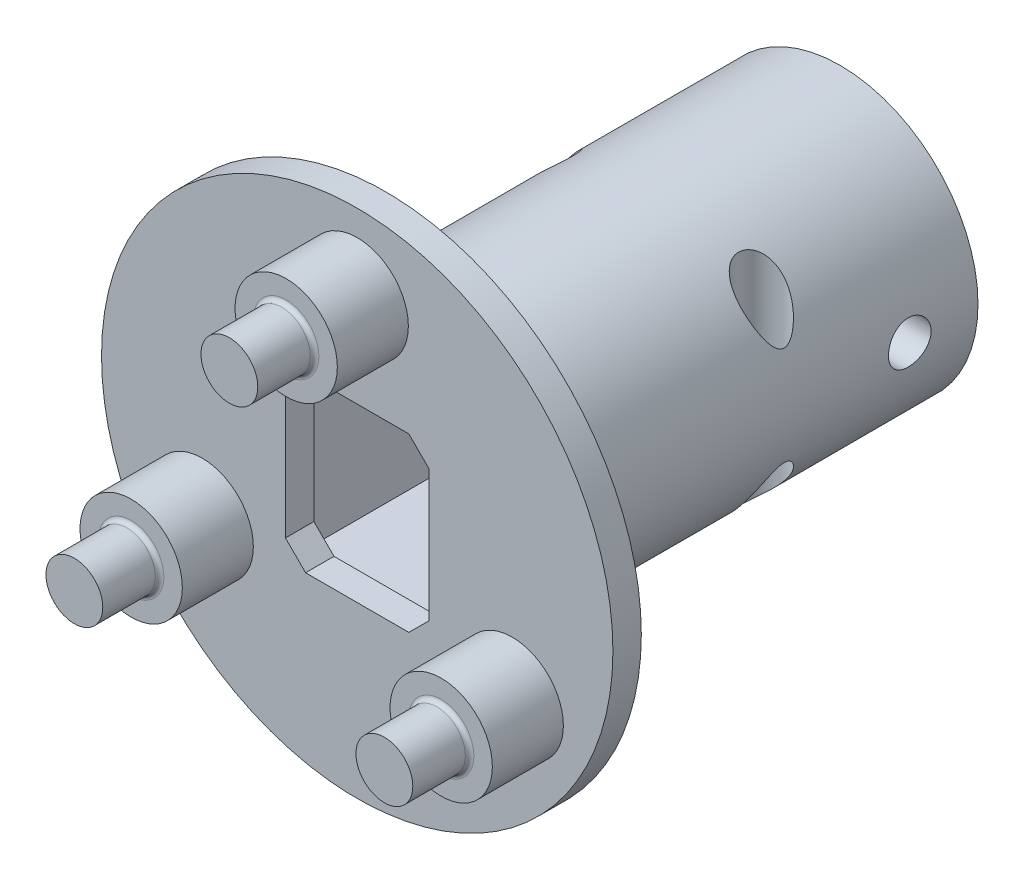
from build123d import *
from build123d.topology import SkipClean

# Parameters (mm, degrees)
SKETCH1_R               = 9.7
SKETCH1_W               = 10.1
SKETCH1_H               = 12.1
BOSS_EXTRUDE1_DEPTH     = 34
BOSS_EXTRUDE2_DEPTH     = 4
SKETCH7_W               = 10.1
SKETCH7_H               = 12.1
CUT_EXTRUDE3_DEPTH      = 2
CUT_EXTRUDE4_REACH      = 38.511
CUT_EXTRUDE5_DEPTH      = 39.275740737
CUT_EXTRUDE5_DEPTH_BACK = 39.275740737
SKETCH10_R              = 1.6
CUT_EXTRUDE6_DEPTH      = 41.209263059
CUT_EXTRUDE6_DEPTH_BACK = 41.209263059
SKETCH12_R              = 1.5
SKETCH13_R              = 14.7
SKETCH13_R_2            = 9.7
CUT_EXTRUDE_THIN1_DEPTH = 39.275740826
BOSS_EXTRUDE3_START     = -2
SKETCH15_R              = 18
SKETCH15_R_2            = 9.7
BOSS_EXTRUDE3_DEPTH     = 2
SKETCH26_R              = 3.6
BOSS_EXTRUDE9_DEPTH     = 12.5
SKETCH27_R              = 2
BOSS_EXTRUDE10_DEPTH    = 5.5
CIRPATTERN1_COUNT       = 3
SKETCH19_R              = 2.5
BOSS_EXTRUDE6_DEPTH     = 4
SKETCH20_W              = 10.3
SKETCH20_H              = 12.3
SKETCH20_W_2            = 10.1
SKETCH20_H_2            = 12.1
CUT_EXTRUDE_THIN2_DEPTH = 21.5
CHAMFER1_SIZE           = 0.1
SKETCH23_W              = 10.3
SKETCH23_H              = 12.3
CUT_EXTRUDE7_DEPTH      = 32
CUT_EXTRUDE8_START      = -4
CUT_EXTRUDE8_DEPTH      = 4
FILLET1_R               = 0.3
CUT_EXTRUDE9_START      = -0.5
SKETCH29_R              = 3.6
SKETCH29_R_2            = 2
CUT_EXTRUDE9_DEPTH      = 0.5
CUT_EXTRUDE10_START     = -0.5
SKETCH30_R              = 2
CUT_EXTRUDE10_DEPTH     = 0.5
CUT_EXTRUDE11_START     = -7
SKETCH31_R              = 3.6
SKETCH31_R_2            = 2
CUT_EXTRUDE11_DEPTH     = 7
CUT_EXTRUDE12_START     = -8.5
SKETCH32_R              = 2
CUT_EXTRUDE12_DEPTH     = 8.5
FILLET2_R               = 0.3


# Some blends are built 0.0001 mm under size
with BuildPart() as part:
    # Sketch1 → Boss-Extrude1 (new body)
    with BuildSketch(Plane.XY):
        Circle(SKETCH1_R)
        Rectangle(SKETCH1_W, SKETCH1_H, mode=Mode.SUBTRACT)
    extrude(amount=BOSS_EXTRUDE1_DEPTH)

    # Sketch5 → Boss-Extrude2 (add)
    with BuildSketch(Plane.XY.offset(34)):
        with BuildLine():
            ThreePointArc((-3.902147571, 8.865750199), (-4.761039652, 10.097562259), (-5.97741096, 10.978185561))
            ThreePointArc((-5.97741096, 10.978185561), (-6.25, 10.825317547), (-6.518682103, 10.665682521))
            ThreePointArc((-6.518682103, 10.665682521), (-6.364225607, 9.171962417), (-5.72689111, 7.812234025))
            ThreePointArc((-5.72689111, 7.812234025), (-6.226362181, 7.420289498), (-6.699084431, 6.996466968))
            ThreePointArc((-6.699084431, 6.996466968), (-7.927483519, 7.860233279), (-9.37168957, 8.271725008))
            ThreePointArc((-9.37168957, 8.271725008), (-9.575555539, 8.034845121), (-9.773435734, 7.792942573))
            ThreePointArc((-9.773435734, 7.792942573), (-9.11741174, 6.442132047), (-8.053458717, 5.382386547))
            ThreePointArc((-8.053458717, 5.382386547), (-8.388755074, 4.84325), (-8.688012841, 4.283306564))
            ThreePointArc((-8.688012841, 4.283306564), (-10.137755877, 4.67484416), (-11.635604106, 4.567572341))
            ThreePointArc((-11.635604106, 4.567572341), (-11.74615776, 4.275251792), (-11.849368775, 3.98025874))
            ThreePointArc((-11.849368775, 3.98025874), (-10.770903459, 2.935285476), (-9.408660347, 2.303343816))
            ThreePointArc((-9.408660347, 2.303343816), (-9.5393403, 1.682043073), (-9.629038681, 1.053516174))
            ThreePointArc((-9.629038681, 1.053516174), (-11.125265259, 0.925599843), (-12.496093063, 0.31250304))
            ThreePointArc((-12.496093063, 0.31250304), (-12.5, 0), (-12.496093063, -0.31250304))
            ThreePointArc((-12.496093063, -0.31250304), (-11.125265259, -0.925599843), (-9.629038681, -1.053516174))
            ThreePointArc((-9.629038681, -1.053516174), (-9.5393403, -1.682043073), (-9.408660347, -2.303343816))
            ThreePointArc((-9.408660347, -2.303343816), (-10.770903459, -2.935285476), (-11.849368775, -3.98025874))
            ThreePointArc((-11.849368775, -3.98025874), (-11.74615776, -4.275251792), (-11.635604106, -4.567572341))
            ThreePointArc((-11.635604106, -4.567572341), (-10.137755877, -4.67484416), (-8.688012841, -4.283306564))
            ThreePointArc((-8.688012841, -4.283306564), (-8.388755074, -4.84325), (-8.053458717, -5.382386547))
            ThreePointArc((-8.053458717, -5.382386547), (-9.11741174, -6.442132047), (-9.773435734, -7.792942573))
            ThreePointArc((-9.773435734, -7.792942573), (-9.575555539, -8.034845121), (-9.37168957, -8.271725008))
            ThreePointArc((-9.37168957, -8.271725008), (-7.927483519, -7.860233279), (-6.699084431, -6.996466968))
            ThreePointArc((-6.699084431, -6.996466968), (-6.226362181, -7.420289498), (-5.72689111, -7.812234025))
            ThreePointArc((-5.72689111, -7.812234025), (-6.364225607, -9.171962417), (-6.518682103, -10.665682521))
            ThreePointArc((-6.518682103, -10.665682521), (-6.25, -10.825317547), (-5.97741096, -10.978185561))
            ThreePointArc((-5.97741096, -10.978185561), (-4.761039652, -10.097562259), (-3.902147571, -8.865750199))
            ThreePointArc((-3.902147571, -8.865750199), (-3.312978118, -9.102332571), (-2.709575915, -9.299810784))
            ThreePointArc((-2.709575915, -9.299810784), (-2.84341994, -10.795518755), (-2.477679205, -12.251983748))
            ThreePointArc((-2.477679205, -12.251983748), (-2.170602221, -12.310096913), (-1.862168372, -12.360514915))
            ThreePointArc((-1.862168372, -12.360514915), (-1.020344137, -11.116976207), (-0.634554124, -9.665693111))
            ThreePointArc((-0.634554124, -9.665693111), (0, -9.6865), (0.634554124, -9.665693111))
            ThreePointArc((0.634554124, -9.665693111), (1.020344137, -11.116976207), (1.862168372, -12.360514915))
            ThreePointArc((1.862168372, -12.360514915), (2.170602221, -12.310096913), (2.477679205, -12.251983748))
            ThreePointArc((2.477679205, -12.251983748), (2.84341994, -10.795518755), (2.709575915, -9.299810784))
            ThreePointArc((2.709575915, -9.299810784), (3.312978118, -9.102332571), (3.902147571, -8.865750199))
            ThreePointArc((3.902147571, -8.865750199), (4.761039652, -10.097562259), (5.97741096, -10.978185561))
            ThreePointArc((5.97741096, -10.978185561), (6.25, -10.825317547), (6.518682103, -10.665682521))
            ThreePointArc((6.518682103, -10.665682521), (6.364225607, -9.171962417), (5.72689111, -7.812234025))
            ThreePointArc((5.72689111, -7.812234025), (6.226362181, -7.420289498), (6.699084431, -6.996466968))
            ThreePointArc((6.699084431, -6.996466968), (7.927483519, -7.860233279), (9.37168957, -8.271725008))
            ThreePointArc((9.37168957, -8.271725008), (9.575555539, -8.034845121), (9.773435734, -7.792942573))
            ThreePointArc((9.773435734, -7.792942573), (9.11741174, -6.442132047), (8.053458717, -5.382386547))
            ThreePointArc((8.053458717, -5.382386547), (8.388755074, -4.84325), (8.688012841, -4.283306564))
            ThreePointArc((8.688012841, -4.283306564), (10.137755877, -4.67484416), (11.635604106, -4.567572341))
            ThreePointArc((11.635604106, -4.567572341), (11.74615776, -4.275251792), (11.849368775, -3.98025874))
            ThreePointArc((11.849368775, -3.98025874), (10.770903459, -2.935285476), (9.408660347, -2.303343816))
            ThreePointArc((9.408660347, -2.303343816), (9.5393403, -1.682043073), (9.629038681, -1.053516174))
            ThreePointArc((9.629038681, -1.053516174), (11.125265259, -0.925599843), (12.496093063, -0.31250304))
            ThreePointArc((12.496093063, -0.31250304), (12.5, 0), (12.496093063, 0.31250304))
            ThreePointArc((12.496093063, 0.31250304), (11.125265259, 0.925599843), (9.629038681, 1.053516174))
            ThreePointArc((9.629038681, 1.053516174), (9.5393403, 1.682043073), (9.408660347, 2.303343816))
            ThreePointArc((9.408660347, 2.303343816), (10.770903459, 2.935285476), (11.849368775, 3.98025874))
            ThreePointArc((11.849368775, 3.98025874), (11.74615776, 4.275251792), (11.635604106, 4.567572341))
            ThreePointArc((11.635604106, 4.567572341), (10.137755877, 4.67484416), (8.688012841, 4.283306564))
            ThreePointArc((8.688012841, 4.283306564), (8.388755074, 4.84325), (8.053458717, 5.382386547))
            ThreePointArc((8.053458717, 5.382386547), (9.11741174, 6.442132047), (9.773435734, 7.792942573))
            ThreePointArc((9.773435734, 7.792942573), (9.575555539, 8.034845121), (9.37168957, 8.271725008))
            ThreePointArc((9.37168957, 8.271725008), (7.927483519, 7.860233279), (6.699084431, 6.996466968))
            ThreePointArc((6.699084431, 6.996466968), (6.226362181, 7.420289498), (5.72689111, 7.812234025))
            ThreePointArc((5.72689111, 7.812234025), (6.364225607, 9.171962417), (6.518682103, 10.665682521))
            ThreePointArc((6.518682103, 10.665682521), (6.25, 10.825317547), (5.97741096, 10.978185561))
            ThreePointArc((5.97741096, 10.978185561), (4.761039652, 10.097562259), (3.902147571, 8.865750199))
            ThreePointArc((3.902147571, 8.865750199), (3.312978118, 9.102332571), (2.709575915, 9.299810784))
            ThreePointArc((2.709575915, 9.299810784), (2.84341994, 10.795518755), (2.477679205, 12.251983748))
            ThreePointArc((2.477679205, 12.251983748), (2.170602221, 12.310096913), (1.862168372, 12.360514915))
            ThreePointArc((1.862168372, 12.360514915), (1.020344137, 11.116976207), (0.634554124, 9.665693111))
            ThreePointArc((0.634554124, 9.665693111), (0, 9.6865), (-0.634554124, 9.665693111))
            ThreePointArc((-0.634554124, 9.665693111), (-1.020344137, 11.116976207), (-1.862168372, 12.360514915))
            ThreePointArc((-1.862168372, 12.360514915), (-2.170602221, 12.310096913), (-2.477679205, 12.251983748))
            ThreePointArc((-2.477679205, 12.251983748), (-2.84341994, 10.795518755), (-2.709575915, 9.299810784))
            ThreePointArc((-2.709575915, 9.299810784), (-3.312978118, 9.102332571), (-3.902147571, 8.865750199))
        make_face()
    extrude(amount=-BOSS_EXTRUDE2_DEPTH)

    # Sketch7 → Cut-Extrude3 (cut)
    with BuildSketch(Plane(origin=(0, 0, 30), x_dir=(-1, 0, 0), z_dir=(0, 0, -1))):
        Rectangle(SKETCH7_W, SKETCH7_H)
    extrude(amount=-CUT_EXTRUDE3_DEPTH, mode=Mode.SUBTRACT)

    # Sketch8 → Cut-Extrude4 (cut, up to next)
    with BuildSketch(Plane(origin=(0, 0, 32), x_dir=(-1, 0, 0), z_dir=(0, 0, -1)), mode=Mode.PRIVATE) as cut_extrude4_sk1:
        Polygon((-5.05, -4.635786438), (-3.635786438, -6.05), (3.635786438, -6.05), (5.05, -4.635786438), (5.05, 4.635786438), (3.635786438, 6.05), (-3.635786438, 6.05), (-5.05, 4.635786438), align=None)
    cut_extrude4_tool1 = extrude(cut_extrude4_sk1.sketch, amount=-CUT_EXTRUDE4_REACH, mode=Mode.PRIVATE) & part.part
    add(cut_extrude4_tool1.solids().sort_by_distance((0, 0, 32))[0], mode=Mode.SUBTRACT)

    # Sketch10 → Cut-Extrude5 (cut, two sides: drawn at the far end of the back side and taken through both)
    with BuildSketch(Plane(origin=(0, 0, 0), x_dir=(1, 0, 0), z_dir=(0, 1, 0)).offset(-CUT_EXTRUDE5_DEPTH_BACK)):
        with Locations(Location((7.45, -13, 0), (0, 0, 270))):
            Circle(SKETCH10_R)
        with Locations(Location((-7.45, -13, 0), (0, 0, 270))):
            Circle(SKETCH10_R)
    extrude(amount=CUT_EXTRUDE5_DEPTH + CUT_EXTRUDE5_DEPTH_BACK, mode=Mode.SUBTRACT)

    # Sketch12 → Cut-Extrude6 (cut, two sides: drawn at the far end of the back side and taken through both)
    with BuildSketch(Plane.ZY.offset(-5.05).offset(-CUT_EXTRUDE6_DEPTH_BACK)):
        with Locations(Location((4.8, 0, 0), (0, 0, 270))):
            Circle(SKETCH12_R)
    extrude(amount=CUT_EXTRUDE6_DEPTH + CUT_EXTRUDE6_DEPTH_BACK, mode=Mode.SUBTRACT)

    # Sketch13 → Cut-Extrude-Thin1 (cut, through all)
    with SkipClean():  # the faces are left unmerged after this step: merging them gives an invalid solid
        with BuildSketch(Plane(origin=(0, 0, 0), x_dir=(-1, 0, 0), z_dir=(0, 0, -1))):
            Circle(SKETCH13_R)
            Circle(SKETCH13_R_2, mode=Mode.SUBTRACT)
        extrude(amount=-CUT_EXTRUDE_THIN1_DEPTH, mode=Mode.SUBTRACT)
    add(part.part.scale(1), mode=Mode.REPLACE)  # the faces are merged on a copy

    # Sketch15 → Boss-Extrude3 (add)
    with BuildSketch(Plane.XY.offset(34).offset(BOSS_EXTRUDE3_START)):
        Circle(SKETCH15_R)
        Circle(SKETCH15_R_2, mode=Mode.SUBTRACT)
    extrude(amount=BOSS_EXTRUDE3_DEPTH)

    # Sketch26 → Boss-Extrude9 (add)
    with BuildSketch(Plane.XY.offset(34)):
        with Locations((0, 12.6)):
            Circle(SKETCH26_R)
    boss_extrude9 = extrude(amount=BOSS_EXTRUDE9_DEPTH)

    # Sketch27 → Boss-Extrude10 (add)
    with BuildSketch(Plane.XY.offset(46.5)):
        with Locations((0, 12.6)):
            Circle(SKETCH27_R)
    boss_extrude10 = extrude(amount=BOSS_EXTRUDE10_DEPTH)

    # CirPattern1: Boss-Extrude9, Boss-Extrude10 ×3 about axis
    cirpattern1_axis = Axis((0, 0, 0), (0, 0, 1))
    add([boss_extrude9.rotate(cirpattern1_axis, i * 360 / CIRPATTERN1_COUNT) for i in range(1, CIRPATTERN1_COUNT)])
    add([boss_extrude10.rotate(cirpattern1_axis, i * 360 / CIRPATTERN1_COUNT) for i in range(1, CIRPATTERN1_COUNT)])

    # Sketch19 → Boss-Extrude6 (add)
    with BuildSketch(Plane(origin=(0, 0, 32), x_dir=(-1, 0, 0), z_dir=(0, 0, -1))):
        with Locations(Location((15.316989719, 5.574928336, 0), (0, 0, 70.299613612))):
            Circle(SKETCH19_R)
    extrude(amount=BOSS_EXTRUDE6_DEPTH)

    # Sketch20 → Cut-Extrude-Thin2 (cut)
    with BuildSketch(Plane(origin=(0, 0, 0), x_dir=(-1, 0, 0), z_dir=(0, 0, -1))):
        Rectangle(SKETCH20_W, SKETCH20_H)
        Rectangle(SKETCH20_W_2, SKETCH20_H_2, mode=Mode.SUBTRACT)
    extrude(amount=-CUT_EXTRUDE_THIN2_DEPTH, mode=Mode.SUBTRACT)

    # Chamfer1
    chamfer1_edges = [part.edges().sort_by_distance(p)[0] for p in [
        (5.05, 0, 21.5),
        (0, -6.05, 21.5),
        (-5.05, 0, 21.5),
        (0, 6.05, 21.5),
    ]]
    chamfer(chamfer1_edges, length=CHAMFER1_SIZE - 0.0001)  # a hair under: the kernel refuses the full size

    # Sketch23 → Cut-Extrude7 (cut)
    with BuildSketch(Plane(origin=(0, 0, 0), x_dir=(-1, 0, 0), z_dir=(0, 0, -1))):
        Rectangle(SKETCH23_W, SKETCH23_H)
    extrude(amount=-CUT_EXTRUDE7_DEPTH, mode=Mode.SUBTRACT)

    # Sketch28 → Cut-Extrude8 (cut)
    with BuildSketch(Plane(origin=(0, 0, 28), x_dir=(-1, 0, 0), z_dir=(0, 0, -1)).offset(CUT_EXTRUDE8_START)):
        with BuildLine():
            ThreePointArc((14.77091445, 3.135296848), (14.189358574, 5.164504164), (13.3305069, 7.092784064))
            ThreePointArc((13.3305069, 7.092784064), (12.967758167, 4.719877978), (14.77091445, 3.135296848))
        make_face()
        with BuildLine():
            ThreePointArc((17.081562792, 3.803973263), (16.444620864, 5.985352508), (15.530383138, 8.065804336))
            ThreePointArc((15.530383138, 8.065804336), (17.666221271, 6.429978695), (17.081562792, 3.803973263))
        make_face()
    extrude(amount=CUT_EXTRUDE8_DEPTH, mode=Mode.SUBTRACT)

    # Fillet1
    # the kernel refuses this fillet: 0.3 mm, written as the material it adds along each edge
    with BuildSketch(Plane(origin=(-15.316989719, 5.574928336, 32), x_dir=(0.4971011086580964, -0.8676926228630111, 0), z_dir=(0.8676926228630111, 0.4971011086580964, 0))) as fillet1_piece_1_section:
        with BuildLine():
            CenterArc((2.5 + FILLET1_R, FILLET1_R), FILLET1_R, 180, 90)
            Line((2.5, FILLET1_R), (2.5, 0))
            Line((2.5, 0), (2.5 + FILLET1_R, 0))
        make_face()
    fillet1_piece_1 = revolve(axis=Axis((-15.316989719, 5.574928336, 32), (0, 0, -1)), revolution_arc=91.896523831, mode=Mode.PRIVATE)
    fillet1_piece_1 = fillet1_piece_1 & Plane(origin=(0, 0, 31.914860787), x_dir=(-0.9760893023906327, 0.21736990076495918, 0), z_dir=(0, 0, 1)) * Cylinder(17.5, 12, mode=Mode.PRIVATE)
    fillet1_piece_1 = fillet1_piece_1 - Plane(origin=(0, 0, 31.914860787), x_dir=(-0.9782062549409082, 0.2076355528190754, 0), z_dir=(0, 0, 1)) * Cylinder(15.1, 12, mode=Mode.PRIVATE)
    add(fillet1_piece_1)
    with BuildSketch(Plane(origin=(-15.316989719, 5.574928336, 32), x_dir=(-0.37603227853722215, 0.9266065645667015, 0), z_dir=(-0.9266065645667015, -0.37603227853722215, 0))) as fillet1_piece_2_section:
        with BuildLine():
            CenterArc((2.5 + FILLET1_R, FILLET1_R), FILLET1_R, 180, 90)
            Line((2.5, FILLET1_R), (2.5, 0))
            Line((2.5, 0), (2.5 + FILLET1_R, 0))
        make_face()
    fillet1_piece_2 = revolve(axis=Axis((-15.316989719, 5.574928336, 32), (0, 0, -1)), revolution_arc=91.896523831, mode=Mode.PRIVATE)
    fillet1_piece_2 = fillet1_piece_2 & Plane(origin=(0, 0, 31.914860787), x_dir=(-0.9760893023906327, 0.21736990076495918, 0), z_dir=(0, 0, 1)) * Cylinder(17.5, 12, mode=Mode.PRIVATE)
    fillet1_piece_2 = fillet1_piece_2 - Plane(origin=(0, 0, 31.914860787), x_dir=(-0.9782062549409082, 0.2076355528190754, 0), z_dir=(0, 0, 1)) * Cylinder(15.1, 12, mode=Mode.PRIVATE)
    add(fillet1_piece_2)

    # Sketch29 → Cut-Extrude9 (cut)
    # profile 1 of 3: a face of its own
    with BuildSketch(Plane.XY.offset(46.5).offset(CUT_EXTRUDE9_START)):
        with Locations(Location((-10.911920088, -6.3, 0), (0, 0, 120))):
            Circle(SKETCH29_R)
        with Locations(Location((-10.911920088, -6.3, 0), (0, 0, 120))):
            Circle(SKETCH29_R_2, mode=Mode.SUBTRACT)
    # profile 2 of 3: a face of its own
    with BuildSketch(Plane.XY.offset(46.5).offset(CUT_EXTRUDE9_START)):
        with Locations(Location((10.911920088, -6.3, 0), (0, 0, 240))):
            Circle(SKETCH29_R)
        with Locations(Location((10.911920088, -6.3, 0), (0, 0, 240))):
            Circle(SKETCH29_R_2, mode=Mode.SUBTRACT)
    # profile 3 of 3: a face of its own
    with BuildSketch(Plane.XY.offset(46.5).offset(CUT_EXTRUDE9_START)):
        with Locations((0, 12.6)):
            Circle(SKETCH29_R)
        with Locations((0, 12.6)):
            Circle(SKETCH29_R_2, mode=Mode.SUBTRACT)
    extrude(amount=CUT_EXTRUDE9_DEPTH, mode=Mode.SUBTRACT)

    # Sketch30 → Cut-Extrude10 (cut)
    with BuildSketch(Plane.XY.offset(52).offset(CUT_EXTRUDE10_START)):
        with Locations((-10.911920088, -6.3)):
            Circle(SKETCH30_R)
        with Locations((0, 12.6)):
            Circle(SKETCH30_R)
        with Locations((10.911920088, -6.3)):
            Circle(SKETCH30_R)
    extrude(amount=CUT_EXTRUDE10_DEPTH, mode=Mode.SUBTRACT)

    # Sketch31 → Cut-Extrude11 (cut)
    # profile 1 of 3: a face of its own
    with BuildSketch(Plane.XY.offset(46).offset(CUT_EXTRUDE11_START)):
        with Locations((0, 12.6)):
            Circle(SKETCH31_R)
        with Locations((0, 12.6)):
            Circle(SKETCH31_R_2, mode=Mode.SUBTRACT)
    # profile 2 of 3: a face of its own
    with BuildSketch(Plane.XY.offset(46).offset(CUT_EXTRUDE11_START)):
        with Locations(Location((-10.911920088, -6.3, 0), (0, 0, 120))):
            Circle(SKETCH31_R)
        with Locations((-10.911920088, -6.3)):
            Circle(SKETCH31_R_2, mode=Mode.SUBTRACT)
    # profile 3 of 3: a face of its own
    with BuildSketch(Plane.XY.offset(46).offset(CUT_EXTRUDE11_START)):
        with Locations(Location((10.911920088, -6.3, 0), (0, 0, 240))):
            Circle(SKETCH31_R)
        with Locations((10.911920088, -6.3)):
            Circle(SKETCH31_R_2, mode=Mode.SUBTRACT)
    extrude(amount=CUT_EXTRUDE11_DEPTH, mode=Mode.SUBTRACT)

    # Sketch32 → Cut-Extrude12 (cut)
    with BuildSketch(Plane.XY.offset(51.5).offset(CUT_EXTRUDE12_START)):
        with Locations((-10.911920088, -6.3)):
            Circle(SKETCH32_R)
        with Locations((0, 12.6)):
            Circle(SKETCH32_R)
        with Locations((10.911920088, -6.3)):
            Circle(SKETCH32_R)
    extrude(amount=CUT_EXTRUDE12_DEPTH, mode=Mode.SUBTRACT)

    # Fillet2
    fillet2_edges = [part.edges().sort_by_distance(p)[0] for p in [
        (-2, 12.6, 39),
        (-12.911920088, -6.3, 39),
        (8.911920088, -6.3, 39),
    ]]
    fillet(fillet2_edges, radius=FILLET2_R)


solid = part.part
